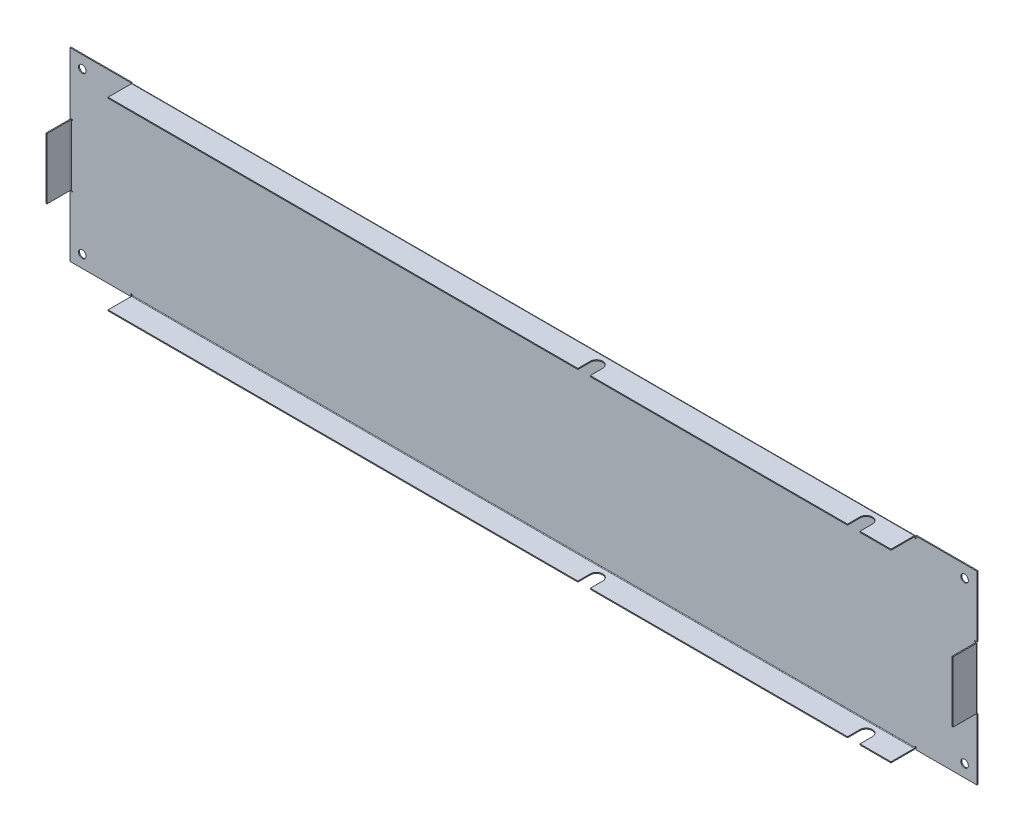
from build123d import *

# Parameters (mm, degrees)
SKETCH_1_W                        = 730
SKETCH_1_H                        = 149
SKETCH_1_R                        = 3
SM_BASE_FLANGE_1_DEPTH            = 0.8
SM_EDGE_FLANGE_1_STRIP_W          = 4.2
SM_EDGE_FLANGE_1_STRIP_H          = 0.8
SM_EDGE_FLANGE_1_STRIP_CUT_DEPTH  = 49
SM_EDGE_FLANGE_1_RELIEF_W         = 5
SM_EDGE_FLANGE_1_RELIEF_H         = 0.8
SM_EDGE_FLANGE_1_RELIEF_CUT_DEPTH = 0.8
SM_EDGE_FLANGE_1_DEPTH            = 49
SM_EDGE_FLANGE_2_STRIP_W          = 4.2
SM_EDGE_FLANGE_2_STRIP_H          = 0.8
SM_EDGE_FLANGE_2_STRIP_CUT_DEPTH  = 49
SM_EDGE_FLANGE_2_RELIEF_W         = 5
SM_EDGE_FLANGE_2_RELIEF_H         = 0.8
SM_EDGE_FLANGE_2_RELIEF_CUT_DEPTH = 0.8
SM_EDGE_FLANGE_2_DEPTH            = 49
SM_EDGE_FLANGE_3_STRIP_W          = 4.2
SM_EDGE_FLANGE_3_STRIP_H          = 0.8
SM_EDGE_FLANGE_3_STRIP_CUT_DEPTH  = 630
SM_EDGE_FLANGE_3_RELIEF_W         = 5
SM_EDGE_FLANGE_3_RELIEF_H         = 0.8
SM_EDGE_FLANGE_3_RELIEF_CUT_DEPTH = 0.8
SM_EDGE_FLANGE_3_DEPTH            = 630
SM_EDGE_FLANGE_3_FLAT_DEPTH       = 0.8


# Sheet-metal steps are written as plain solids
with BuildPart() as part:
    # Sketch 1 → 基体-法兰1 (new body)
    with BuildSketch(Plane.XY):
        Rectangle(SKETCH_1_W, SKETCH_1_H)
        with Locations((-355, 64.5)):
            Circle(SKETCH_1_R, mode=Mode.SUBTRACT)
        with Locations((-355, -64.5)):
            Circle(SKETCH_1_R, mode=Mode.SUBTRACT)
        with Locations((355, 64.5)):
            Circle(SKETCH_1_R, mode=Mode.SUBTRACT)
        with Locations((355, -64.5)):
            Circle(SKETCH_1_R, mode=Mode.SUBTRACT)
    extrude(amount=-SM_BASE_FLANGE_1_DEPTH)

    # 边线-法兰1 strip (across the edge) → 边线-法兰1 strip cut (cut)
    with BuildSketch(Plane(origin=(-365, 24.5, 0), x_dir=(1, 0, 0), z_dir=(0, -1, 0))):
        with Locations((-0.8, -0.4)):
            Rectangle(SM_EDGE_FLANGE_1_STRIP_W, SM_EDGE_FLANGE_1_STRIP_H)
    extrude(amount=SM_EDGE_FLANGE_1_STRIP_CUT_DEPTH, mode=Mode.SUBTRACT)

    # 边线-法兰1 relief (on the sheet) → 边线-法兰1 relief cut (cut)
    with BuildSketch(Plane(origin=(-363.7, 24.5, 0), x_dir=(1, 0, 0), z_dir=(0, 0, 1))):
        with Locations((-1.7, 0.4)):
            Rectangle(SM_EDGE_FLANGE_1_RELIEF_W, SM_EDGE_FLANGE_1_RELIEF_H)
        with Locations((-1.7, -49.4)):
            Rectangle(SM_EDGE_FLANGE_1_RELIEF_W, SM_EDGE_FLANGE_1_RELIEF_H)
    extrude(amount=-SM_EDGE_FLANGE_1_RELIEF_CUT_DEPTH, mode=Mode.SUBTRACT)

    # 边线-法兰1 section (across the edge) → 边线-法兰1 (add)
    with BuildSketch(Plane(origin=(-365, 24.5, 0), x_dir=(1, 0, 0), z_dir=(0, -1, 0))):
        with BuildLine():
            Line((0, 0.5), (0, 19.2))
            Line((0, 19.2), (0.8, 19.2))
            Line((0.8, 19.2), (0.8, 0.5))
            ThreePointArc((0.8, 0.5), (0.946446609, 0.146446609), (1.3, 0))
            Line((1.3, 0), (1.3, -0.8))
            ThreePointArc((1.3, -0.8), (0.380761184, -0.419238816), (0, 0.5))
        make_face()
    extrude(amount=SM_EDGE_FLANGE_1_DEPTH)

    # 边线-法兰2 strip (across the edge) → 边线-法兰2 strip cut (cut)
    with BuildSketch(Plane(origin=(365, -24.5, 0), x_dir=(-1, 0, 0), z_dir=(0, 1, 0))):
        with Locations((-0.8, -0.4)):
            Rectangle(SM_EDGE_FLANGE_2_STRIP_W, SM_EDGE_FLANGE_2_STRIP_H)
    extrude(amount=SM_EDGE_FLANGE_2_STRIP_CUT_DEPTH, mode=Mode.SUBTRACT)

    # 边线-法兰2 relief (on the sheet) → 边线-法兰2 relief cut (cut)
    with BuildSketch(Plane(origin=(363.7, -24.5, 0), x_dir=(-1, 0, 0), z_dir=(0, 0, 1))):
        with Locations((-1.7, 0.4)):
            Rectangle(SM_EDGE_FLANGE_2_RELIEF_W, SM_EDGE_FLANGE_2_RELIEF_H)
        with Locations((-1.7, -49.4)):
            Rectangle(SM_EDGE_FLANGE_2_RELIEF_W, SM_EDGE_FLANGE_2_RELIEF_H)
    extrude(amount=-SM_EDGE_FLANGE_2_RELIEF_CUT_DEPTH, mode=Mode.SUBTRACT)

    # 边线-法兰2 section (across the edge) → 边线-法兰2 (add)
    with BuildSketch(Plane(origin=(365, -24.5, 0), x_dir=(-1, 0, 0), z_dir=(0, 1, 0))):
        with BuildLine():
            Line((0, 0.5), (0, 19.2))
            Line((0, 19.2), (0.8, 19.2))
            Line((0.8, 19.2), (0.8, 0.5))
            ThreePointArc((0.8, 0.5), (0.946446609, 0.146446609), (1.3, 0))
            Line((1.3, 0), (1.3, -0.8))
            ThreePointArc((1.3, -0.8), (0.380761184, -0.419238816), (0, 0.5))
        make_face()
    extrude(amount=SM_EDGE_FLANGE_2_DEPTH)

    # 边线-法兰3 strip (across the edge) → 边线-法兰3 strip cut (cut)
    with BuildSketch(Plane(origin=(315, 74.5, 0), x_dir=(0, -1, 0), z_dir=(-1, 0, 0))):
        with Locations((-0.8, -0.4)):
            Rectangle(SM_EDGE_FLANGE_3_STRIP_W, SM_EDGE_FLANGE_3_STRIP_H)
    sm_edge_flange_3_strip_cut = extrude(amount=SM_EDGE_FLANGE_3_STRIP_CUT_DEPTH, mode=Mode.SUBTRACT)

    # 边线-法兰3 relief (on the sheet) → 边线-法兰3 relief cut (cut)
    with BuildSketch(Plane(origin=(315, 73.2, 0), x_dir=(0, -1, 0), z_dir=(0, 0, 1))):
        with Locations((-1.7, 0.4)):
            Rectangle(SM_EDGE_FLANGE_3_RELIEF_W, SM_EDGE_FLANGE_3_RELIEF_H)
        with Locations((-1.7, -630.4)):
            Rectangle(SM_EDGE_FLANGE_3_RELIEF_W, SM_EDGE_FLANGE_3_RELIEF_H)
    sm_edge_flange_3_relief_cut = extrude(amount=-SM_EDGE_FLANGE_3_RELIEF_CUT_DEPTH, mode=Mode.SUBTRACT)

    # 边线-法兰3 bend section (across the edge) → 边线-法兰3 (add)
    with BuildSketch(Plane(origin=(315, 74.5, 0), x_dir=(0, -1, 0), z_dir=(-1, 0, 0))):
        with BuildLine():
            Line((0, 0.5), (0.8, 0.5))
            ThreePointArc((0.8, 0.5), (0.946446609, 0.146446609), (1.3, 0))
            Line((1.3, 0), (1.3, -0.8))
            ThreePointArc((1.3, -0.8), (0.380761184, -0.419238816), (0, 0.5))
        make_face()
    sm_edge_flange_3 = extrude(amount=SM_EDGE_FLANGE_3_DEPTH)

    # 边线-法兰3 profile (on flange) → 边线-法兰3 flat (add)
    with BuildSketch(Plane(origin=(0, 74.5, 0), x_dir=(-1, 0, 0), z_dir=(0, 1, 0))):
        with BuildLine():
            Line((-315, 0.5), (315, 0.5))
            Line((315, 0.5), (315, 19.2))
            Line((315, 19.2), (-63, 19.2))
            Line((-63, 19.2), (-63, 9.2))
            ThreePointArc((-63, 9.2), (-68, 4.2), (-73, 9.2))
            Line((-73, 9.2), (-73, 19.2))
            Line((-73, 19.2), (-280, 19.2))
            Line((-280, 19.2), (-280, 9.2))
            ThreePointArc((-280, 9.2), (-285, 4.2), (-290, 9.2))
            Line((-290, 9.2), (-290, 19.2))
            Line((-290, 19.2), (-315, 19.2))
            Line((-315, 19.2), (-315, 0.5))
        make_face()
    sm_edge_flange_3_flat = extrude(amount=-SM_EDGE_FLANGE_3_FLAT_DEPTH)

    # 镜向1: 边线-法兰3 strip cut, 边线-法兰3 relief cut, 边线-法兰3, 边线-法兰3 flat across plane
    add(sm_edge_flange_3_strip_cut.mirror(Plane.ZX), mode=Mode.SUBTRACT)
    add(sm_edge_flange_3_relief_cut.mirror(Plane.ZX), mode=Mode.SUBTRACT)
    add(sm_edge_flange_3.mirror(Plane.ZX))
    add(sm_edge_flange_3_flat.mirror(Plane.ZX))


solid = part.part
